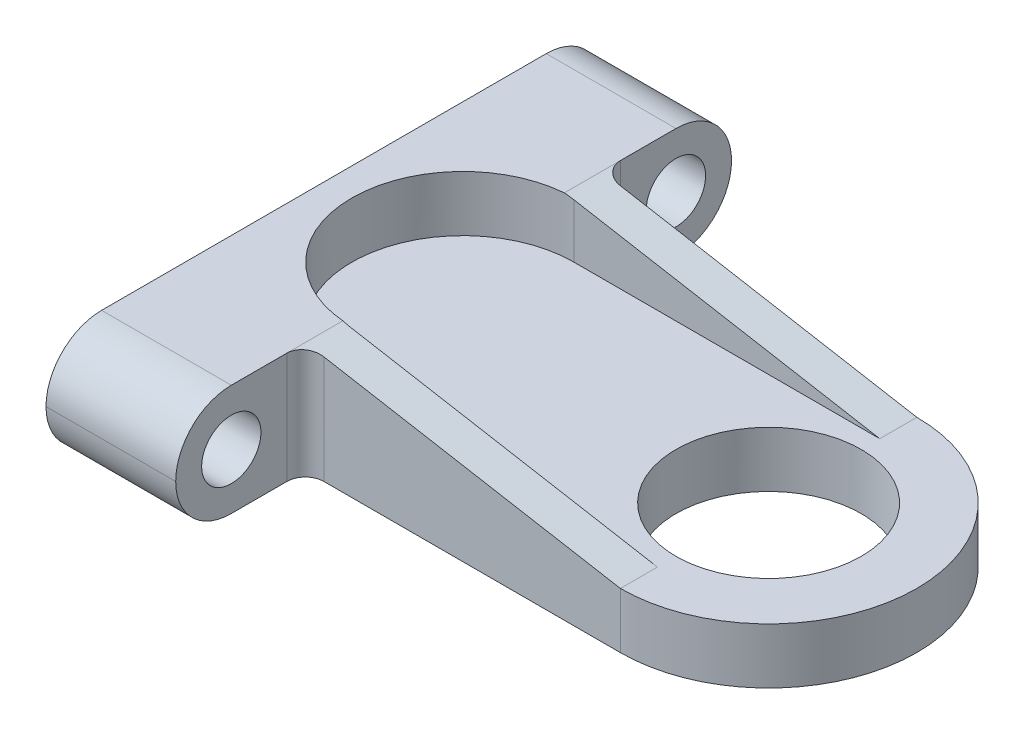
from build123d import *

# Parameters (mm, degrees)
SKETCH1_R               = 5
BOSS_EXTRUDE1_DEPTH     = 6
FILLET1_R               = 3
SKETCH2_R               = 1.6
CUT_EXTRUDE1_DEPTH      = 36.846896658
CUT_EXTRUDE2_DEPTH      = 29.930952283
CUT_EXTRUDE2_DEPTH_BACK = 29.930952283
CUT_EXTRUDE3_DEPTH      = 29.460498942
FILLET3_R               = 1


with BuildPart() as part:
    # Sketch1 → Boss-Extrude1 (new body)
    with BuildSketch(Plane(origin=(0, 0, 0), x_dir=(1, 0, 0), z_dir=(0, 1, 0))):
        with BuildLine():
            Line((0, 8), (-17, 8))
            Line((-17, 8), (-17, 15))
            Line((-17, 15), (-24, 15))
            Line((-24, 15), (-24, -15))
            Line((-24, -15), (-17, -15))
            Line((-17, -15), (-17, -8))
            Line((-17, -8), (0, -8))
            ThreePointArc((0, -8), (8, 0), (0, 8))
        make_face()
        with Locations(Location((0, 0, 0), (0, 0, 270))):
            Circle(SKETCH1_R, mode=Mode.SUBTRACT)
    extrude(amount=BOSS_EXTRUDE1_DEPTH)

    # Fillet1
    fillet1_edges = [part.edges().sort_by_distance(p)[0] for p in [
        (-20.5, 0, -15),
        (-20.5, 6, -15),
        (-20.5, 0, 15),
        (-20.5, 6, 15),
    ]]
    fillet(fillet1_edges, radius=FILLET1_R - 0.0001)  # a hair under: the kernel refuses the full size

    # Sketch2 → Cut-Extrude1 (cut, through all)
    with BuildSketch(Plane.ZY.offset(24)):
        with Locations((-12, 3)):
            Circle(SKETCH2_R)
        with Locations((12, 3)):
            Circle(SKETCH2_R)
    extrude(amount=-CUT_EXTRUDE1_DEPTH, mode=Mode.SUBTRACT)

    # Sketch3 → Cut-Extrude2 (cut, two sides: drawn at the far end of the back side and taken through both)
    with BuildSketch(Plane.XY.offset(-CUT_EXTRUDE2_DEPTH_BACK)):
        Polygon((-17, 6), (8, 6), (8, 3), (0, 3), align=None)
    extrude(amount=CUT_EXTRUDE2_DEPTH + CUT_EXTRUDE2_DEPTH_BACK, mode=Mode.SUBTRACT)

    # Sketch4 → Cut-Extrude3 (cut, through all)
    with BuildSketch(Plane(origin=(0, 3, 0), x_dir=(1, 0, 0), z_dir=(0, 1, 0))):
        with BuildLine():
            Line((0, -6), (-16.5, -6))
            ThreePointArc((-16.5, -6), (-22.5, 0), (-16.5, 6))
            Line((-16.5, 6), (0, 6))
            ThreePointArc((0, 6), (6, 0), (0, -6))
        make_face()
    extrude(amount=CUT_EXTRUDE3_DEPTH, mode=Mode.SUBTRACT)

    # Fillet3
    fillet3_edges = [part.edges().sort_by_distance(p)[0] for p in [
        (-17, 3, -8),
        (-17, 3, 8),
    ]]
    fillet(fillet3_edges, radius=FILLET3_R)


solid = part.part
